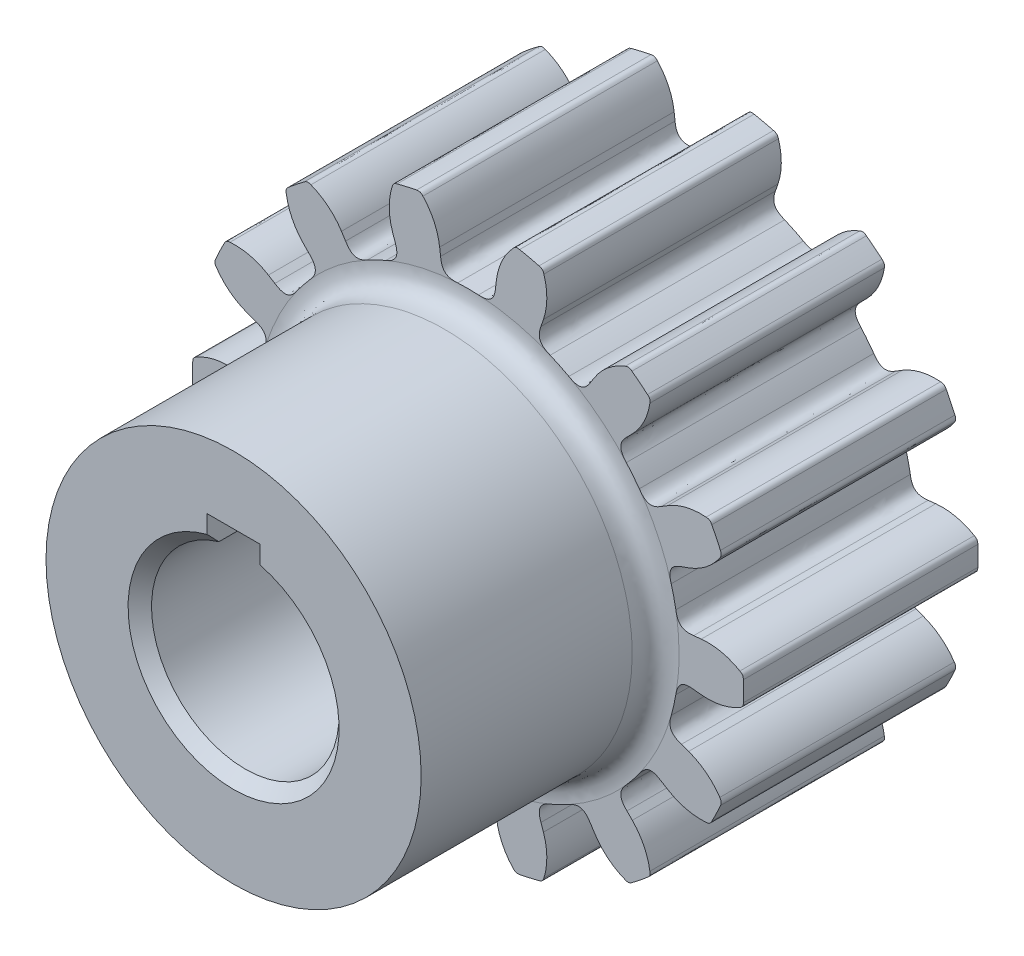
from build123d import *
from build123d.topology import SkipClean

# Parameters (mm, degrees)
BOSS_EXTRUDE1_DEPTH = 10
CIRPATTERN1_COUNT   = 14
SKETCH2_R           = 8
SKETCH2_R_2         = 4
BOSS_EXTRUDE2_DEPTH = 10
SKETCH3_W           = 2.25
SKETCH3_H           = 2.25
CUT_EXTRUDE1_DEPTH  = 26.913982084
CHAMFER1_SIZE       = 0.5
FILLET3_SIZE        = 1


with BuildPart() as part:
    # Sketch1 → Boss-Extrude1 (new body)
    with BuildSketch(Plane.XY):
        with BuildLine():
            Line((8.952325354, -0.925132831), (9.947028171, -1.027925368))
            ThreePointArc((9.947028171, -1.027925368), (10.880032983, -0.962410319), (11.735466749, -0.584226143))
            ThreePointArc((11.735466749, -0.584226143), (11.75, 0), (11.735466749, 0.584226143))
            ThreePointArc((11.735466749, 0.584226143), (10.880032983, 0.962410319), (9.947028171, 1.027925368))
            Line((9.947028171, 1.027925368), (8.952325354, 0.925132831))
            ThreePointArc((8.952325354, 0.925132831), (8.850722073, 1.63239664), (8.693332437, 2.329371406))
            Line((8.693332437, 2.329371406), (3.863703305, 1.03527618))
            ThreePointArc((3.863703305, 1.03527618), (4, 0), (3.863703305, -1.03527618))
            Line((3.863703305, -1.03527618), (8.693332437, -2.329371406))
            ThreePointArc((8.693332437, -2.329371406), (8.850722073, -1.63239664), (8.952325354, -0.925132831))
        make_face()
    boss_extrude1 = extrude(amount=BOSS_EXTRUDE1_DEPTH)

    # Fillet1
    # a fillet whose section is not a circle: 0.7 mm, written as the material it adds along each edge
    with BuildSketch(Plane(origin=(8.952325354, -0.925132831, 0), x_dir=(-0.13864026890955974, -0.9903428072322659, 0), z_dir=(0, 0, 1))) as fillet1_piece_1:
        with BuildLine():
            add(Edge.make_bspline([(0.649908299, 0), (0.539210747, 0.003999455), (0.428513196, 0.007998911), (0.18537866, 0.061447942), (0.037086877, 0.209739726), (-0.016362154, 0.452874261), (-0.02036161, 0.563571813), (-0.024361065, 0.674269364)], knots=[0, 0, 0, 0, 0, 0, 0.5, 0.5, 1, 1, 1, 1, 1, 1], degree=5))
            Line((-0.024361065, 0.674269364), (0, 0))
            ThreePointArc((0, 0), (0.324954149, 0.005868313), (0.649908299, 0))
        make_face()
    extrude(amount=10)
    with BuildSketch(Plane(origin=(8.952325354, 0.925132831, 0), x_dir=(0.9947028171171741, 0.10279253678724733, 0), z_dir=(0, 0, 1))) as fillet1_piece_2:
        with BuildLine():
            add(Edge.make_bspline([(0.674709298, 0), (0.563939521, 0), (0.453169743, 0), (0.208263909, 0.044635561), (0.054714591, 0.187476427), (-0.007478209, 0.428522599), (-0.015471905, 0.539003568), (-0.0234656, 0.649484536)], knots=[0, 0, 0, 0, 0, 0, 0.5, 0.5, 1, 1, 1, 1, 1, 1], degree=5))
            ThreePointArc((-0.0234656, 0.649484536), (-0.005868313, 0.324954149), (0, 0))
            Line((0, 0), (0.674709298, 0))
        make_face()
    extrude(amount=10)

    # Fillet2
    # a fillet whose section is not a circle: 0.3 mm, written as the material it takes off along each edge (its section moved 0.00015 mm through the faces so that the kernel can cut it)
    with BuildSketch(Plane(origin=(11.735466749, -0.584226143, -0.418251198), x_dir=(-0.8475588208343505, -0.5307014652569609, 0), z_dir=(0, 0, 1))) as fillet2_piece_1:
        with BuildLine():
            add(Edge.make_bspline([(0.167300479, 0), (0.137546975, 0.000943651), (0.107793471, 0.001887301), (0.041162476, -0.003442936), (-0.013864915, -0.031517087), (-0.0572887, -0.082335153), (-0.073988149, -0.106978405), (-0.090687598, -0.131621658)], knots=[0, 0, 0, 0, 0, 0, 0.5, 0.5, 1, 1, 1, 1, 1, 1], degree=5))
            Line((-0.090687598, -0.131621658), (-0.095654583, -0.128255791))
            ThreePointArc((-0.095654583, -0.128255791), (-0.050449933, -0.062299754), (-0.00492074, 0.003433121))
            Line((-0.00492074, 0.003433121), (-0.000179449, 0.005997316))
            ThreePointArc((-0.000179449, 0.005997316), (0.08365671, 0.007213681), (0.167490677, 0.005996985))
            Line((0.167490677, 0.005996985), (0.167300479, 0))
        make_face()
    extrude(amount=10.836502396, mode=Mode.SUBTRACT)
    with BuildSketch(Plane(origin=(11.735466749, 0.584226143, -0.418251198), x_dir=(-0.8475588208343496, 0.5307014652569623, 0), z_dir=(0, 0, 1))) as fillet2_piece_2:
        with BuildLine():
            add(Edge.make_bspline([(0.167300479, 0), (0.137546975, -0.000943651), (0.107793471, -0.001887301), (0.041162476, 0.003442936), (-0.013864915, 0.031517087), (-0.0572887, 0.082335153), (-0.073988149, 0.106978405), (-0.090687598, 0.131621658)], knots=[0, 0, 0, 0, 0, 0, 0.5, 0.5, 1, 1, 1, 1, 1, 1], degree=5))
            Line((-0.090687598, 0.131621658), (-0.095654583, 0.128255791))
            ThreePointArc((-0.095654583, 0.128255791), (-0.050449933, 0.062299754), (-0.00492074, -0.003433121))
            Line((-0.00492074, -0.003433121), (-0.000179449, -0.005997316))
            ThreePointArc((-0.000179449, -0.005997316), (0.08365671, -0.007213681), (0.167490677, -0.005996985))
            Line((0.167490677, -0.005996985), (0.167300479, 0))
        make_face()
    extrude(amount=10.836502396, mode=Mode.SUBTRACT)

    # CirPattern1: Boss-Extrude1 ×14 about axis
    cirpattern1_axis = Axis((0, 0, 10.555), (0, 0, -1))
    for i in range(1, CIRPATTERN1_COUNT):
        add(boss_extrude1.rotate(cirpattern1_axis, i * 360 / CIRPATTERN1_COUNT))

    # Fillet1 of CirPattern1
    # a fillet whose section is not a circle: 0.7 mm, written as the material it adds along each edge
    with BuildSketch(Plane(origin=(7.664366347, -4.717784278, 0), x_dir=(0.8515962608227778, -0.5241982530995914, 0), z_dir=(0, 0, 1)), Plane(origin=(4.858385588, -7.576020689, 0), x_dir=(0.539820620929689, -0.8417800765158826, 0), z_dir=(0, 0, 1)), Plane(origin=(1.090141979, -8.933733288, 0), x_dir=(0.12112688659602701, -0.992637032023062, 0), z_dir=(0, 0, 1)), Plane(origin=(-2.894017618, -8.522010445, 0), x_dir=(-0.3215575131517542, -0.9468900494437881, 0), z_dir=(0, 0, 1)), Plane(origin=(-6.304981534, -6.422398918, 0), x_dir=(-0.7005535037757342, -0.7135998797278083, 0), z_dir=(0, 0, 1)), Plane(origin=(-8.467166531, -3.050752519, 0), x_dir=(-0.9407962812520373, -0.33897250210354474, 0), z_dir=(0, 0, 1)), Plane(origin=(-8.952325354, 0.925132831, 0), x_dir=(-0.9947028171171742, 0.10279253678724677, 0), z_dir=(0, 0, 1)), Plane(origin=(-7.664366347, 4.717784278, 0), x_dir=(-0.851596260822778, 0.5241982530995911, 0), z_dir=(0, 0, 1)), Plane(origin=(-4.858385588, 7.576020689, 0), x_dir=(-0.5398206209296891, 0.8417800765158826, 0), z_dir=(0, 0, 1)), Plane(origin=(-1.090141979, 8.933733288, 0), x_dir=(-0.12112688659602631, 0.992637032023062, 0), z_dir=(0, 0, 1)), Plane(origin=(2.894017618, 8.522010445, 0), x_dir=(0.32155751315175485, 0.9468900494437879, 0), z_dir=(0, 0, 1)), Plane(origin=(6.304981534, 6.422398918, 0), x_dir=(0.7005535037757333, 0.713599879727809, 0), z_dir=(0, 0, 1)), Plane(origin=(8.467166531, 3.050752519, 0), x_dir=(0.9407962812520371, 0.33897250210354535, 0), z_dir=(0, 0, 1))) as fillet1_of_cirpattern1_piece_1:
        with BuildLine():
            add(Edge.make_bspline([(0.674709298, 0), (0.563939521, 0), (0.453169743, 0), (0.208263909, -0.044635561), (0.054714591, -0.187476427), (-0.007478209, -0.428522599), (-0.015471905, -0.539003568), (-0.0234656, -0.649484536)], knots=[0, 0, 0, 0, 0, 0, 0.5, 0.5, 1, 1, 1, 1, 1, 1], degree=5))
            ThreePointArc((-0.0234656, -0.649484536), (-0.005868313, -0.324954149), (0, 0))
            Line((0, 0), (0.674709298, 0))
        make_face()
    extrude(amount=10)
    with BuildSketch(Plane(origin=(8.467166531, -3.050752519, 0), x_dir=(0.3047830740849944, 0.9524217961340977, 0), z_dir=(0, 0, 1)), Plane(origin=(6.304981534, -6.422398918, 0), x_dir=(0.6878403913378782, 0.7258619676248057, 0), z_dir=(0, 0, 1)), Plane(origin=(2.894017618, -8.522010445, 0), x_dir=(0.9346624832775304, 0.3555362743145627, 0), z_dir=(0, 0, 1)), Plane(origin=(-1.090141979, -8.933733288, 0), x_dir=(0.9963632075209496, -0.0852077384899115, 0), z_dir=(0, 0, 1)), Plane(origin=(-4.858385588, -7.576020689, 0), x_dir=(0.8607219789220166, -0.5090753136821384, 0), z_dir=(0, 0, 1)), Plane(origin=(-7.664366347, -4.717784278, 0), x_dir=(0.5546042063352724, -0.8321142796005983, 0), z_dir=(0, 0, 1)), Plane(origin=(-8.952325354, -0.925132831, 0), x_dir=(0.13864026890956704, -0.9903428072322649, 0), z_dir=(0, 0, 1)), Plane(origin=(-8.467166531, 3.050752519, 0), x_dir=(-0.3047830740849942, -0.9524217961340978, 0), z_dir=(0, 0, 1)), Plane(origin=(-6.304981534, 6.422398918, 0), x_dir=(-0.6878403913378905, -0.725861967624794, 0), z_dir=(0, 0, 1)), Plane(origin=(-2.894017618, 8.522010445, 0), x_dir=(-0.934662483277524, -0.3555362743145797, 0), z_dir=(0, 0, 1)), Plane(origin=(1.090141979, 8.933733288, 0), x_dir=(-0.9963632075209498, 0.08520773848990881, 0), z_dir=(0, 0, 1)), Plane(origin=(4.858385588, 7.576020689, 0), x_dir=(-0.8607219789220172, 0.5090753136821374, 0), z_dir=(0, 0, 1)), Plane(origin=(7.664366347, 4.717784278, 0), x_dir=(-0.5546042063352702, 0.8321142796005996, 0), z_dir=(0, 0, 1))) as fillet1_of_cirpattern1_piece_2:
        with BuildLine():
            add(Edge.make_bspline([(0.649908299, 0), (0.539210747, -0.003999455), (0.428513196, -0.007998911), (0.18537866, -0.061447942), (0.037086877, -0.209739726), (-0.016362154, -0.452874261), (-0.02036161, -0.563571813), (-0.024361065, -0.674269364)], knots=[0, 0, 0, 0, 0, 0, 0.5, 0.5, 1, 1, 1, 1, 1, 1], degree=5))
            Line((-0.024361065, -0.674269364), (0, 0))
            ThreePointArc((0, 0), (0.324954149, -0.005868313), (0.649908299, 0))
        make_face()
    extrude(amount=10)

    # Fillet2 of CirPattern1
    # a fillet whose section is not a circle: 0.3 mm, written as the material it takes off along each edge (its section moved 0.00015 mm through the faces so that the kernel can cut it)
    with BuildSketch(Plane(origin=(10.319803968, -5.61819776, -0.418251198), x_dir=(0.47298672570395295, 0.8810695530478019, 0), z_dir=(0, 0, 1)), Plane(origin=(6.860177447, -9.539416408, -0.418251198), x_dir=(0.8084280668893753, 0.588594988651371, 0), z_dir=(0, 0, 1)), Plane(origin=(2.041808648, -11.571236643, -0.418251198), x_dir=(0.9837503147077749, 0.1795419681087234, 0), z_dir=(0, 0, 1)), Plane(origin=(-3.180965395, -11.311231549, -0.418251198), x_dir=(0.9642287477924516, -0.26507154115559206, 0), z_dir=(0, 0, 1)), Plane(origin=(-7.773710229, -8.810898324, -0.418251198), x_dir=(0.7537298518872904, -0.6571843808049331, 0), z_dir=(0, 0, 1)), Plane(origin=(-10.826776414, -4.565458627, -0.418251198), x_dir=(0.3939455149258532, -0.9191337939983517, 0), z_dir=(0, 0, 1)), Plane(origin=(-11.735466749, 0.584226143, -0.418251198), x_dir=(-0.04386456269134223, -0.9990374868541707, 0), z_dir=(0, 0, 1)), Plane(origin=(-10.319803968, 5.61819776, -0.418251198), x_dir=(-0.47298672570393974, -0.8810695530478091, 0), z_dir=(0, 0, 1)), Plane(origin=(-6.860177447, 9.539416408, -0.418251198), x_dir=(-0.808428066889361, -0.588594988651391, 0), z_dir=(0, 0, 1)), Plane(origin=(-2.041808648, 11.571236643, -0.418251198), x_dir=(-0.9837503147077756, -0.1795419681087195, 0), z_dir=(0, 0, 1)), Plane(origin=(7.773710229, 8.810898324, -0.418251198), x_dir=(-0.7537298518872951, 0.6571843808049277, 0), z_dir=(0, 0, 1)), Plane(origin=(10.826776414, 4.565458627, -0.418251198), x_dir=(-0.3939455149258458, 0.9191337939983548, 0), z_dir=(0, 0, 1))) as fillet2_of_cirpattern1_piece_1:
        with BuildLine():
            add(Edge.make_bspline([(0.159838985, 0), (0.130071412, -0.000230408), (0.100303839, -0.000460816), (0.033819704, 0.006464543), (-0.020519156, 0.035849232), (-0.06271274, 0.087693252), (-0.078816877, 0.112729591), (-0.094921014, 0.13776593)], knots=[0, 0, 0, 0, 0, 0, 0.5, 0.5, 1, 1, 1, 1, 1, 1], degree=5))
            Line((-0.094921014, 0.13776593), (-0.099967228, 0.134520051))
            ThreePointArc((-0.099967228, 0.134520051), (-0.053404386, 0.064795478), (-0.00483676, -0.003550458))
            Line((-0.00483676, -0.003550458), (-3.5179e-05, -0.005999897))
            ThreePointArc((-3.5179e-05, -0.005999897), (0.079925308, -0.006196791), (0.159885426, -0.00599982))
            Line((0.159885426, -0.00599982), (0.159838985, 0))
        make_face()
    extrude(amount=10.836502396, mode=Mode.SUBTRACT)
    with BuildSketch(Plane(origin=(10.826776414, -4.565458627, -0.418251198), x_dir=(-0.5333613751869788, 0.8458874886523945, 0), z_dir=(0, 0, 1)), Plane(origin=(7.773710229, -8.810898324, -0.418251198), x_dir=(-0.1135251679358177, 0.9935351207909785, 0), z_dir=(0, 0, 1)), Plane(origin=(3.180965395, -11.311231549, -0.418251198), x_dir=(0.32879609111983654, 0.9444009373482833, 0), z_dir=(0, 0, 1)), Plane(origin=(-2.041808648, -11.571236643, -0.418251198), x_dir=(0.7059952519097856, 0.7082165659463484, 0), z_dir=(0, 0, 1)), Plane(origin=(-6.860177447, -9.539416408, -0.418251198), x_dir=(0.9433633945954372, 0.33176121795257124, 0), z_dir=(0, 0, 1)), Plane(origin=(-10.319803968, -5.61819776, -0.418251198), x_dir=(0.9938868473886904, -0.11040350804104969, 0), z_dir=(0, 0, 1)), Plane(origin=(-11.735466749, -0.584226143, -0.418251198), x_dir=(0.84755882083435, -0.5307014652569618, 0), z_dir=(0, 0, 1)), Plane(origin=(-10.826776414, 4.565458627, -0.418251198), x_dir=(0.5333613751869711, -0.8458874886523993, 0), z_dir=(0, 0, 1)), Plane(origin=(-7.773710229, 8.810898324, -0.418251198), x_dir=(0.11352516793581531, -0.9935351207909788, 0), z_dir=(0, 0, 1)), Plane(origin=(-3.180965395, 11.311231549, -0.418251198), x_dir=(-0.32879609111982994, -0.9444009373482856, 0), z_dir=(0, 0, 1)), Plane(origin=(2.041808648, 11.571236643, -0.418251198), x_dir=(-0.7059952519097836, -0.7082165659463504, 0), z_dir=(0, 0, 1)), Plane(origin=(6.860177447, 9.539416408, -0.418251198), x_dir=(-0.9433633945954427, -0.33176121795255564, 0), z_dir=(0, 0, 1)), Plane(origin=(10.319803968, 5.61819776, -0.418251198), x_dir=(-0.9938868473886904, 0.11040350804104969, 0), z_dir=(0, 0, 1))) as fillet2_of_cirpattern1_piece_2:
        with BuildLine():
            add(Edge.make_bspline([(0.167300479, 0), (0.137546975, -0.000943651), (0.107793471, -0.001887301), (0.041162476, 0.003442936), (-0.013864915, 0.031517087), (-0.0572887, 0.082335153), (-0.073988149, 0.106978405), (-0.090687598, 0.131621658)], knots=[0, 0, 0, 0, 0, 0, 0.5, 0.5, 1, 1, 1, 1, 1, 1], degree=5))
            Line((-0.090687598, 0.131621658), (-0.095654583, 0.128255791))
            ThreePointArc((-0.095654583, 0.128255791), (-0.050449933, 0.062299754), (-0.00492074, -0.003433121))
            Line((-0.00492074, -0.003433121), (-0.000179449, -0.005997316))
            ThreePointArc((-0.000179449, -0.005997316), (0.08365671, -0.007213681), (0.167490677, -0.005996985))
            Line((0.167490677, -0.005996985), (0.167300479, 0))
        make_face()
    extrude(amount=10.836502396, mode=Mode.SUBTRACT)
    with BuildSketch(Plane(origin=(3.180965395, 11.311231549, -0.418251198), x_dir=(0.32879609111982755, -0.9444009373482865, 0), z_dir=(0, 0, 1))) as fillet2_of_cirpattern1_piece_3:
        with BuildLine():
            add(Edge.make_bspline([(0.167300479, 0), (0.137546975, 0.000943651), (0.107793471, 0.001887301), (0.041162476, -0.003442936), (-0.013864915, -0.031517087), (-0.0572887, -0.082335153), (-0.073988149, -0.106978405), (-0.090687598, -0.131621658)], knots=[0, 0, 0, 0, 0, 0, 0.5, 0.5, 1, 1, 1, 1, 1, 1], degree=5))
            Line((-0.090687598, -0.131621658), (-0.095654583, -0.128255791))
            ThreePointArc((-0.095654583, -0.128255791), (-0.050449933, -0.062299754), (-0.00492074, 0.003433121))
            Line((-0.00492074, 0.003433121), (-0.000179449, 0.005997316))
            ThreePointArc((-0.000179449, 0.005997316), (0.08365671, 0.007213681), (0.167490677, 0.005996985))
            Line((0.167490677, 0.005996985), (0.167300479, 0))
        make_face()
    extrude(amount=10.836502396, mode=Mode.SUBTRACT)

    # Sketch2 → Boss-Extrude2 (add)
    with SkipClean():  # the faces are left unmerged after this step: merging them gives an invalid solid
        with BuildSketch(Plane.XY.offset(10)):
            Circle(SKETCH2_R)
            Circle(SKETCH2_R_2, mode=Mode.SUBTRACT)
        extrude(amount=BOSS_EXTRUDE2_DEPTH)
    add(part.part.scale(1), mode=Mode.REPLACE)  # the faces are merged on a copy

    # Sketch3 → Cut-Extrude1 (cut, through all)
    with BuildSketch(Plane.XY.offset(20)):
        with Locations((0, 4)):
            Rectangle(SKETCH3_W, SKETCH3_H)
    extrude(amount=-CUT_EXTRUDE1_DEPTH, mode=Mode.SUBTRACT)

    # Chamfer1
    chamfer1_edges = [part.edges().sort_by_distance(p)[0] for p in [
        (0, -4, 20),
        (0, -4, 0),
    ]]
    chamfer(chamfer1_edges, length=CHAMFER1_SIZE)

    # Fillet3
    # a fillet whose section is not a circle: 1 mm, written as the material it adds along each edge
    with BuildSketch(Plane(origin=(0, 0, 10), x_dir=(1, 0, 0), z_dir=(0, -1, 0))) as fillet3_piece_1:
        with BuildLine():
            add(Edge.make_bspline([(8, FILLET3_SIZE), (8, FILLET3_SIZE * 0.831801948466), (8, FILLET3_SIZE * 0.663603896932), (8 + FILLET3_SIZE * 0.0716919198361, FILLET3_SIZE * 0.292893218813), (8 + FILLET3_SIZE * 0.292893218813, FILLET3_SIZE * 0.0716919198361), (8 + FILLET3_SIZE * 0.663603896932, 0), (8 + FILLET3_SIZE * 0.831801948466, 0), (8 + FILLET3_SIZE, 0)], knots=[0, 0, 0, 0, 0, 0, 0.5, 0.5, 1, 1, 1, 1, 1, 1], degree=5))
            Line((8 + FILLET3_SIZE, 0), (8 + FILLET3_SIZE, -FILLET3_SIZE * 0.02))
            Line((8 + FILLET3_SIZE, -FILLET3_SIZE * 0.02), (8 - FILLET3_SIZE * 0.02, -FILLET3_SIZE * 0.02))
            Line((8 - FILLET3_SIZE * 0.02, -FILLET3_SIZE * 0.02), (8 - FILLET3_SIZE * 0.02, FILLET3_SIZE))
            Line((8 - FILLET3_SIZE * 0.02, FILLET3_SIZE), (8, FILLET3_SIZE))
        make_face()
    revolve(axis=Axis((0, 0, 10), (0, 0, 1)))


solid = part.part
